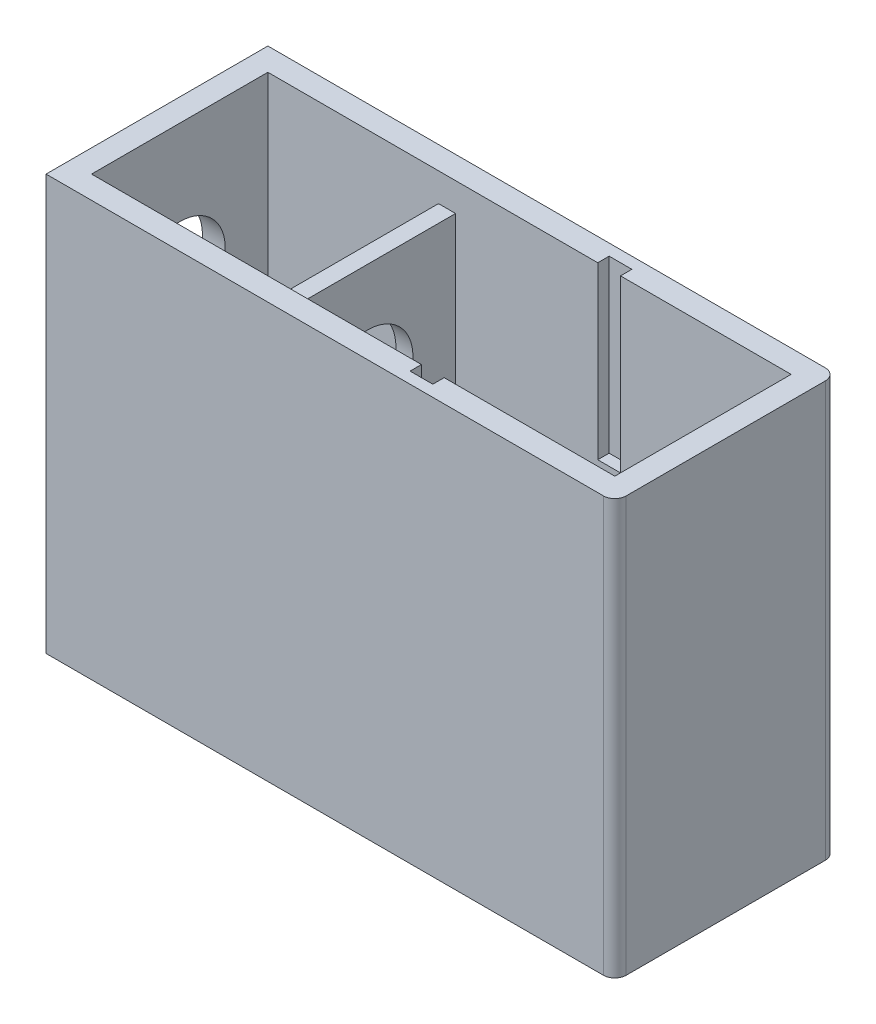
from build123d import *

# Parameters (mm, degrees)
SKETCH1_W               = 92
SKETCH1_H               = 31
BOSS_EXTRUDE2_DEPTH     = 3
SKETCH1_3_W             = 100
SKETCH1_3_H             = 39
SKETCH1_3_W_2           = 92
SKETCH1_3_H_2           = 31
BOSS_EXTRUDE3_DEPTH     = 73
FILLET1_R               = 2
FILLET2_R               = 2
SKETCH3_W               = 7.14
SKETCH3_H               = 31
BOSS_EXTRUDE4_DEPTH     = 28
SKETCH4_W               = 7.14
SKETCH4_H               = 2.85103565
BOSS_EXTRUDE5_DEPTH     = 4
SKETCH5_W               = 7.14
SKETCH5_H               = 5.56896435
CUT_EXTRUDE1_DEPTH      = 28
SKETCH4_3_R             = 0.5
CUT_EXTRUDE3_DEPTH      = 20
LPATTERN5_COUNT         = 2
LPATTERN5_PITCH         = 47.64
LPATTERN6_COUNT         = 2
LPATTERN6_PITCH         = 49
SKETCH10_W              = 2.85103565
SKETCH10_H              = 32
BOSS_EXTRUDE6_DEPTH     = 41
CUT_EXTRUDE4_DEPTH      = 36
CUT_EXTRUDE4_DEPTH_BACK = 35
SKETCH12_R              = 8
SKETCH13_W              = 3
SKETCH13_H              = 31
BOSS_EXTRUDE7_DEPTH     = 65
CUT_EXTRUDE5_START      = -5
SKETCH14_R              = 8
CUT_EXTRUDE5_DEPTH      = 5
SKETCH15_W              = 4
SKETCH15_H              = 2
CUT_EXTRUDE6_DEPTH      = 30


with BuildPart() as part:
    # Sketch1 → Boss-Extrude2 (new body)
    with BuildSketch(Plane(origin=(0, 0, 0), x_dir=(1, 0, 0), z_dir=(0, 1, 0))):
        Rectangle(SKETCH1_W, SKETCH1_H)
    extrude(amount=BOSS_EXTRUDE2_DEPTH)

    # Sketch1<3> → Boss-Extrude3 (add)
    with BuildSketch(Plane(origin=(0, 0, 0), x_dir=(1, 0, 0), z_dir=(0, 1, 0))):
        Rectangle(SKETCH1_3_W, SKETCH1_3_H)
        Rectangle(SKETCH1_3_W_2, SKETCH1_3_H_2, mode=Mode.SUBTRACT)
    extrude(amount=BOSS_EXTRUDE3_DEPTH)

    # Fillet1
    fillet1_edges = [part.edges().sort_by_distance(p)[0] for p in [
        (50, 36.5, 19.5),
    ]]
    fillet(fillet1_edges, radius=FILLET1_R)

    # Fillet2
    fillet2_edges = [part.edges().sort_by_distance(p)[0] for p in [
        (50, 36.5, -19.5),
    ]]
    fillet(fillet2_edges, radius=FILLET2_R)

    # Sketch3 → Boss-Extrude4 (add)
    with BuildSketch(Plane(origin=(0, 3, 0), x_dir=(1, 0, 0), z_dir=(0, 1, 0))):
        with Locations((42.43, 0)):
            Rectangle(SKETCH3_W, SKETCH3_H)
    boss_extrude4 = extrude(amount=BOSS_EXTRUDE4_DEPTH)

    # Sketch4 → Boss-Extrude5 (add)
    with BuildSketch(Plane(origin=(0, 31, 0), x_dir=(1, 0, 0), z_dir=(0, 1, 0))):
        with Locations((42.43, -8.505517825)):
            Rectangle(SKETCH4_W, SKETCH4_H)
    boss_extrude5 = extrude(amount=BOSS_EXTRUDE5_DEPTH)

    # Sketch5 → Cut-Extrude1 (cut)
    with BuildSketch(Plane(origin=(0, 31, 0), x_dir=(1, 0, 0), z_dir=(0, 1, 0))):
        with Locations((42.43, -12.715517825)):
            Rectangle(SKETCH5_W, SKETCH5_H)
    cut_extrude1 = extrude(amount=-CUT_EXTRUDE1_DEPTH, mode=Mode.SUBTRACT)

    # Sketch4<3> → Cut-Extrude3 (cut)
    with BuildSketch(Plane(origin=(0, 31, 0), x_dir=(1, 0, 0), z_dir=(0, 1, 0))):
        with Locations((43.36, 8.92)):
            Circle(SKETCH4_3_R)
        with Locations((43.36, -1.08)):
            Circle(SKETCH4_3_R)
    cut_extrude3 = extrude(amount=-CUT_EXTRUDE3_DEPTH, mode=Mode.SUBTRACT)

    # LPattern5: Boss-Extrude4, Boss-Extrude5, Cut-Extrude1 ×2
    with Locations(*[(-i * LPATTERN5_PITCH, 0, 0) for i in range(1, LPATTERN5_COUNT)]):
        add(boss_extrude4)
        add(boss_extrude5)
        add(cut_extrude1, mode=Mode.SUBTRACT)

    # LPattern6: Cut-Extrude3 ×2
    with Locations(*[(-i * LPATTERN6_PITCH, 0, 0) for i in range(1, LPATTERN6_COUNT)]):
        add(cut_extrude3, mode=Mode.SUBTRACT)

    # Sketch10 → Boss-Extrude6 (add)
    with BuildSketch(Plane.ZY.offset(-38.86)):
        with Locations((8.505517825, 19)):
            Rectangle(SKETCH10_W, SKETCH10_H)
    extrude(amount=BOSS_EXTRUDE6_DEPTH)

    # Sketch12 → Cut-Extrude4 (cut, two sides: drawn at the far end of the back side and taken through both)
    with BuildSketch(Plane(origin=(-46, 0, 0), x_dir=(0, 0, -1), z_dir=(1, 0, 0)).offset(-CUT_EXTRUDE4_DEPTH_BACK)):
        with Locations((0, 50)):
            Circle(SKETCH12_R)
    extrude(amount=CUT_EXTRUDE4_DEPTH + CUT_EXTRUDE4_DEPTH_BACK, mode=Mode.SUBTRACT)

    # Sketch13 → Boss-Extrude7 (add)
    with BuildSketch(Plane(origin=(0, 3, 0), x_dir=(1, 0, 0), z_dir=(0, 1, 0))):
        with Locations((-14.5, 0)):
            Rectangle(SKETCH13_W, SKETCH13_H)
    extrude(amount=BOSS_EXTRUDE7_DEPTH)

    # Sketch14 → Cut-Extrude5 (cut)
    with BuildSketch(Plane.ZY.offset(16).offset(CUT_EXTRUDE5_START)):
        with Locations((0, 50)):
            Circle(SKETCH14_R)
    extrude(amount=CUT_EXTRUDE5_DEPTH, mode=Mode.SUBTRACT)

    # Sketch15 → Cut-Extrude6 (cut)
    with BuildSketch(Plane(origin=(0, 73, 0), x_dir=(1, 0, 0), z_dir=(0, 1, 0))):
        with Locations((14, 16.5)):
            Rectangle(SKETCH15_W, SKETCH15_H)
        with Locations((14, -16.5)):
            Rectangle(SKETCH15_W, SKETCH15_H)
    extrude(amount=-CUT_EXTRUDE6_DEPTH, mode=Mode.SUBTRACT)


solid = part.part
